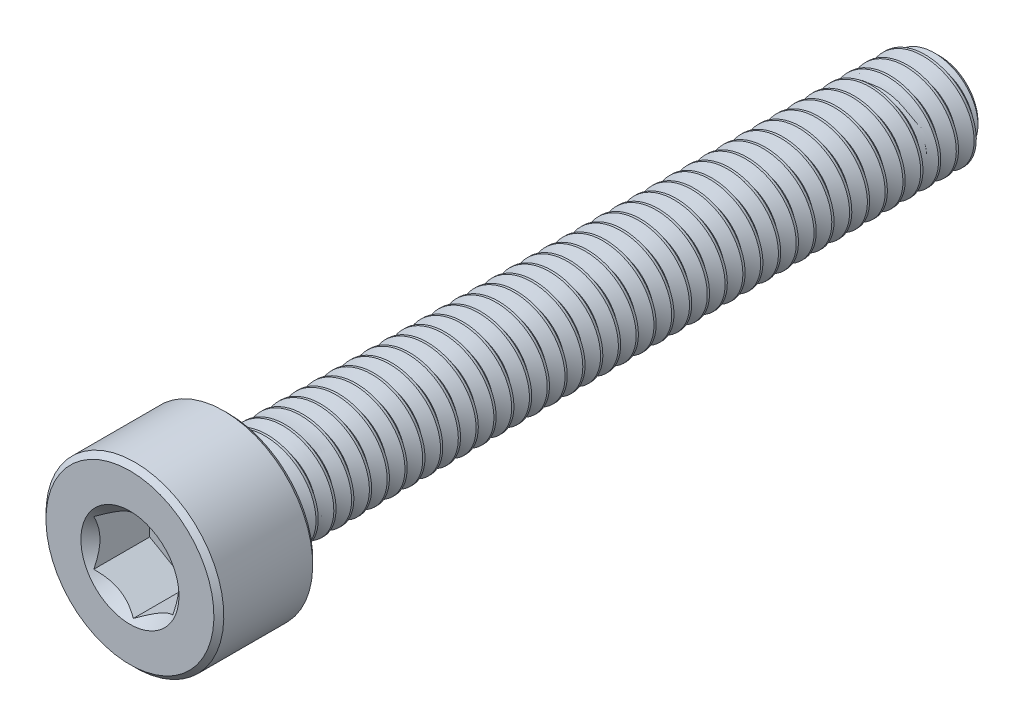
from build123d import *

# Parameters (mm, degrees)
CUT_EXTRUDE1_DEPTH     = 1.5
SPLIT1_SURFACE_1_BACK  = 22.465
SPLIT1_SURFACE_1_DEPTH = 44.93
SPLIT1_SURFACE_2_BACK  = 22.465
SPLIT1_SURFACE_2_DEPTH = 44.93
CUT_SWEEP1_PITCH       = 0.45
CUT_SWEEP1_TO          = 17.875


with BuildPart() as part:
    # Sketch2 → Revolve1 (revolve)
    with BuildSketch(Plane(origin=(0, 0, 0), x_dir=(0, 0, -1), z_dir=(1, 0, 0))):
        with BuildLine():
            Line((-10.25, 0), (-10.25, 2.125))
            Line((-10.25, 2.125), (-10.125, 2.25))
            Line((-10.125, 2.25), (-7.875, 2.25))
            Line((-7.875, 2.25), (-7.75, 2.125))
            Line((-7.75, 2.125), (-7.75, 1.375))
            ThreePointArc((-7.75, 1.375), (-7.713388348, 1.286611652), (-7.625, 1.25))
            Line((-7.625, 1.25), (9.957716426, 1.25))
            Line((9.957716426, 1.25), (10.25, 0.957716426))
            Line((10.25, 0.957716426), (10.25, 0))
            Line((10.25, 0), (-10.25, 0))
        make_face()
    revolve(axis=Axis((0, 0, -10.25), (0, 0, 1)))

    # Sketch3 → Cut-Extrude1 (cut)
    with BuildSketch(Plane.XY.offset(10.25)):
        Polygon((1, -0.577350269), (1, 0.577350269), (0, 1.154700538), (-1, 0.577350269), (-1, -0.577350269), (0, -1.154700538), align=None)
    extrude(amount=-CUT_EXTRUDE1_DEPTH, mode=Mode.SUBTRACT)

    # Cut-Extrude2 cone 1 section (through the dimple's axis) → Cut-Extrude2 (revolve, cut)
    with BuildSketch(Plane(origin=(0, 0, 10.25), x_dir=(0, -1, 0), z_dir=(1, 0, 0))):
        Polygon((0, 0), (1.241303079, 0), (0, 1.241303079), align=None)
    revolve(axis=Axis((0, 0, 10.25), (0, 0, -1)), mode=Mode.SUBTRACT)


with BuildPart() as body_2:
    # Split1: the piece behind the surface
    add(part.part)
    # Split1 surface: a surface, the sketch's curves swept straight by 44.93 mm
    with BuildLine(Plane(origin=(0, 0, 0), x_dir=(0, 0, -1), z_dir=(1, 0, 0)).offset(-SPLIT1_SURFACE_1_BACK), mode=Mode.PRIVATE) as split1_surface_1_path:
        Line((-7.625, -2.25), (-7.625, 2.25))
    split1_surface_1 = Shell.extrude(split1_surface_1_path.wire(), (1 * SPLIT1_SURFACE_1_DEPTH, 0 * SPLIT1_SURFACE_1_DEPTH, 0 * SPLIT1_SURFACE_1_DEPTH))
    split(bisect_by=split1_surface_1, keep=Keep.BOTTOM)

    # Cut-Sweep1: arcs per turn and ends read off the stored shape
    # Cut-Sweep1: the profile of Sketch7 screwed along a right-hand helix through 41 turns, 6 arcs to a turn; built about Z, then put on its axis
    cut_sweep1_z = Axis((0, 0, 0), (0, 0, 1))
    cut_sweep1_corners = [(1.274356964, 0, 0.0140625), (1.274356964, 0, -0.4078125), (0.957716426, 0, -0.225), (0.957716426, 0, -0.16875)]
    with BuildLine(mode=Mode.PRIVATE) as cut_sweep1_profile:
        Line(cut_sweep1_corners[0], cut_sweep1_corners[1])
        Line(cut_sweep1_corners[1], cut_sweep1_corners[2])
        Line(cut_sweep1_corners[2], cut_sweep1_corners[3])
        Line(cut_sweep1_corners[3], cut_sweep1_corners[0])
    cut_sweep1_cap = Face(cut_sweep1_profile.wire())
    cut_sweep1_turn_angles = [0, 30, 60, 90, 120, 150, 180, 210, 240, 270, 300, 330, 360]
    cut_sweep1_turn_weights = [1, 0.8660254037844387, 1, 0.8660254037844387, 1, 0.8660254037844387, 1, 0.8660254037844387, 1, 0.8660254037844387, 1, 0.8660254037844387, 1]
    cut_sweep1_turn_rails = [Edge.make_bspline([Vector(p[0], p[1], 0).rotate(cut_sweep1_z, cut_sweep1_turn_angles[k]) / cut_sweep1_turn_weights[k] + Vector(0, 0, p[2] + CUT_SWEEP1_PITCH * cut_sweep1_turn_angles[k] / 360) for k in range(13)], [0, 0, 0, 1, 1, 2, 2, 3, 3, 4, 4, 5, 5, 6, 6, 6], 2, cut_sweep1_turn_weights) for p in cut_sweep1_corners]
    cut_sweep1_turn_sides = [Face.make_surface_from_curves(cut_sweep1_turn_rails[p[0]], cut_sweep1_turn_rails[p[1]]) for p in [(0, 1), (1, 2), (2, 3), (3, 0)]]
    cut_sweep1 = Plane(origin=(0, 0, -10.25), x_dir=(0, 1, 0), z_dir=(0, 0, 1)) * split(Solid(Shell([*[p.moved(Location((0, 0, CUT_SWEEP1_PITCH * i))) for i in range(41) for p in cut_sweep1_turn_sides], cut_sweep1_cap, cut_sweep1_cap.rotate(cut_sweep1_z, 14760).moved(Location((0, 0, CUT_SWEEP1_PITCH * 14760 / 360)))])), bisect_by=Plane.XY.offset(CUT_SWEEP1_TO), keep=Keep.BOTTOM, mode=Mode.PRIVATE)
    add(cut_sweep1, mode=Mode.SUBTRACT)


with BuildPart() as part_1:
    add(part.part)

    # Split1: split by a surface, the side it looks to stays
    # Split1 surface: a surface, the sketch's curves swept straight by 44.93 mm
    with BuildLine(Plane(origin=(0, 0, 0), x_dir=(0, 0, -1), z_dir=(1, 0, 0)).offset(-SPLIT1_SURFACE_2_BACK), mode=Mode.PRIVATE) as split1_surface_2_path:
        Line((-7.625, -2.25), (-7.625, 2.25))
    split1_surface_2 = Shell.extrude(split1_surface_2_path.wire(), (1 * SPLIT1_SURFACE_2_DEPTH, 0 * SPLIT1_SURFACE_2_DEPTH, 0 * SPLIT1_SURFACE_2_DEPTH))
    split(bisect_by=split1_surface_2, keep=Keep.TOP)

    add(body_2.part)  # Revolve2 merges body 2
    # Sketch8 → Revolve2 (revolve)
    with BuildSketch(Plane(origin=(0, 0, 0), x_dir=(0, 0, -1), z_dir=(1, 0, 0)), mode=Mode.PRIVATE) as revolve2_sk:
        Polygon((-7.75, 0), (-7.75, 1.25), (-7.625, 1.25), (-6.903312164, 0), align=None)
    revolve(revolve2_sk.sketch.rotate(Axis((0, 0, 6.903312164), (0, 0, 1)), 270), axis=Axis((0, 0, 6.903312164), (0, 0, 1)))


solid = part_1.part
